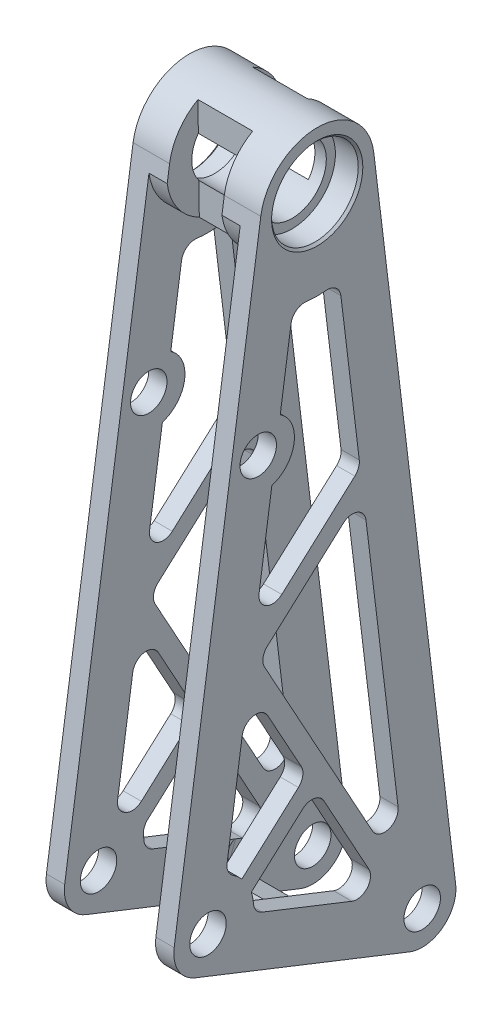
from build123d import *

# Parameters (mm, degrees)
SKETCH2_R               = 7.5
SKETCH2_R_2             = 4
BOSS_EXTRUDE1_DEPTH     = 14
SKETCH5_R               = 9.5
CUT_EXTRUDE2_DEPTH      = 5.5
CUT_EXTRUDE3_DEPTH      = 614.488906728
CUT_EXTRUDE3_DEPTH_BACK = 614.488906728
CUT_EXTRUDE4_DEPTH      = 10
BOSS_EXTRUDE2_DEPTH     = 10
FILLET2_R               = 3
FILLET3_R               = 3
BOSS_EXTRUDE4_DEPTH     = 4
BOSS_EXTRUDE5_START     = -4
BOSS_EXTRUDE5_DEPTH     = 4
CUT_EXTRUDE5_DEPTH      = 614.488906728
CUT_EXTRUDE5_DEPTH_BACK = 614.488906728
SKETCH13_R              = 4
CUT_EXTRUDE8_DEPTH      = 6
BOSS_EXTRUDE6_DEPTH     = 4
BOSS_EXTRUDE7_DEPTH     = 4
FILLET4_R               = 3
CHAMFER1_SIZE           = 0.5


with BuildPart() as part:
    # Sketch2 → Boss-Extrude1 (new, symmetric)
    with BuildSketch(Plane(origin=(-412.5, 0, 0), x_dir=(0, 0, -1), z_dir=(1, 0, 0))):
        with BuildLine():
            Line((-456.363295204, -382.527511362), (-437.367335694, -253.183682895))
            ThreePointArc((-437.367335694, -253.183682895), (-424.843445453, -242.500980411), (-412.591051315, -253.494014434))
            Line((-412.591051315, -253.494014434), (-394.642850355, -401.382752344))
            ThreePointArc((-394.642850355, -401.382752344), (-397.465286403, -408.130276264), (-404.70702593, -409.1561578))
            Line((-404.70702593, -409.1561578), (-451.698461175, -390.59274773))
            ThreePointArc((-451.698461175, -390.59274773), (-455.435165708, -387.372352264), (-456.363295204, -382.527511362))
        make_face()
        with Locations((-425, -255)):
            Circle(SKETCH2_R, mode=Mode.SUBTRACT)
        with Locations((-448.942893787, -383.617301625)):
            Circle(SKETCH2_R_2, mode=Mode.SUBTRACT)
        with Locations((-401.988401641, -402.274229495)):
            Circle(SKETCH2_R_2, mode=Mode.SUBTRACT)
    extrude(amount=BOSS_EXTRUDE1_DEPTH, both=True)

    # Sketch5 → Cut-Extrude2 (cut)
    with BuildSketch(Plane.ZY.offset(426.5)):
        with Locations((425, -255)):
            Circle(SKETCH5_R)
    cut_extrude2 = extrude(amount=-CUT_EXTRUDE2_DEPTH, mode=Mode.SUBTRACT)

    # Mirror1: Cut-Extrude2 across plane
    add(cut_extrude2.mirror(Plane(origin=(-412.5, 0, 0), x_dir=(0, 0, 1), z_dir=(1, 0, 0))), mode=Mode.SUBTRACT)

    # Sketch7 → Cut-Extrude3 (cut, two sides: drawn at the far end of the back side and taken through both)
    with BuildSketch(Plane(origin=(-412.5, 0, 0), x_dir=(0, 0, -1), z_dir=(1, 0, 0)).offset(-CUT_EXTRUDE3_DEPTH_BACK)):
        with BuildLine():
            Line((-430.742030576, -276.892443556), (-444.757842893, -372.326360609))
            ThreePointArc((-444.757842893, -372.326360609), (-444.527531575, -373.988727486), (-443.440423433, -375.267282463))
            ThreePointArc((-443.440423433, -375.267282463), (-440.325167232, -378.544354845), (-438.971721168, -382.858541714))
            ThreePointArc((-438.971721168, -382.858541714), (-438.395118428, -384.411078634), (-437.082596338, -385.421092184))
            Line((-437.082596338, -385.421092184), (-412.145396393, -395.272237741))
            ThreePointArc((-412.145396393, -395.272237741), (-409.456329, -392.454733995), (-406.02291409, -390.615964607))
            Line((-406.02291409, -390.615964607), (-419.808105653, -277.029394751))
            ThreePointArc((-419.808105653, -277.029394751), (-420.909833502, -275.050094523), (-423.081419559, -274.405387115))
            ThreePointArc((-423.081419559, -274.405387115), (-425.244225094, -274.498470558), (-427.404020675, -274.35124504))
            ThreePointArc((-427.404020675, -274.35124504), (-429.591073298, -274.941358989), (-430.742030576, -276.892443556))
        make_face()
    extrude(amount=CUT_EXTRUDE3_DEPTH + CUT_EXTRUDE3_DEPTH_BACK, mode=Mode.SUBTRACT)

    # Sketch8 → Cut-Extrude4 (cut, symmetric)
    with BuildSketch(Plane(origin=(-412.5, 0, 0), x_dir=(0, 0, -1), z_dir=(1, 0, 0))):
        with BuildLine():
            Line((-451.698461175, -390.59274773), (-404.70702593, -409.1561578))
            ThreePointArc((-404.70702593, -409.1561578), (-397.465286403, -408.130276264), (-394.642850355, -401.382752344))
            Line((-394.642850355, -401.382752344), (-412.160855789, -257.03871919))
            ThreePointArc((-412.160855789, -257.03871919), (-425.162816729, -267.998980372), (-437.886179639, -256.716500603))
            Line((-437.886179639, -256.716500603), (-456.363295204, -382.527511362))
            ThreePointArc((-456.363295204, -382.527511362), (-455.435165708, -387.372352264), (-451.698461175, -390.59274773))
        make_face()
    extrude(amount=CUT_EXTRUDE4_DEPTH, both=True, mode=Mode.SUBTRACT)

    # Sketch10 → Boss-Extrude2 (add, symmetric)
    with BuildSketch(Plane(origin=(-412.5, 0, 0), x_dir=(0, 0, -1), z_dir=(1, 0, 0))):
        Polygon((-428.204297472, -391.713098841), (-422.623940588, -393.917552751), (-424.460985513, -398.567850155), (-430.041342398, -396.363396244), align=None)
    extrude(amount=BOSS_EXTRUDE2_DEPTH, both=True)

    # Fillet2
    # the kernel refuses this fillet: 3 mm, written as the material it adds along each edge
    with BuildSketch(Plane(origin=(-422.5, -396.363396244, 430.041342398), x_dir=(0, 0.36740898506417274, 0.9300594807291169), z_dir=(0, 0.9300594807291169, -0.3674089850641727)), Plane(origin=(-422.5, -393.917552751, 422.623940588), x_dir=(0, -0.36740898506413927, -0.9300594807291301), z_dir=(0, -0.9300594807291301, 0.36740898506413927))) as fillet2_piece_1:
        with BuildLine():
            CenterArc((FILLET2_R, FILLET2_R), FILLET2_R, 180, 90)
            Line((0, FILLET2_R), (-FILLET2_R * 0.02, FILLET2_R))
            Line((-FILLET2_R * 0.02, FILLET2_R), (-FILLET2_R * 0.02, -FILLET2_R * 0.02))
            Line((-FILLET2_R * 0.02, -FILLET2_R * 0.02), (FILLET2_R, -FILLET2_R * 0.02))
            Line((FILLET2_R, -FILLET2_R * 0.02), (FILLET2_R, 0))
        make_face()
    extrude(amount=5)
    with BuildSketch(Plane(origin=(-422.5, -398.567850155, 424.460985513), x_dir=(-2.194748909688179e-14, -0.9300594807291194, 0.3674089850641664), z_dir=(0, 0.3674089850641664, 0.9300594807291194)), Plane(origin=(-422.5, -391.713098841, 428.204297472), x_dir=(-2.194748909688179e-14, 0.9300594807291187, -0.36740898506416797), z_dir=(0, -0.36740898506416797, -0.9300594807291188))) as fillet2_piece_2:
        with BuildLine():
            CenterArc((3, 2.971847642), FILLET2_R, 180, 82.144486147)
            Line((0, 2.971847642), (-0.06, 2.971847642))
            Line((-0.06, 2.971847642), (-0.06, 0))
            Line((-0.06, 0), (0, -0.06))
            ThreePointArc((0, -0.06), (1.294986834, -0.06), (2.581773142, -0.059436953))
            Line((2.581773142, -0.059436953), (2.589973669, 0))
        make_face()
    extrude(amount=6)
    with BuildSketch(Plane(origin=(-402.5, -396.363396244, 430.041342398), x_dir=(0, 0.36740898506417274, 0.9300594807291169), z_dir=(0, 0.9300594807291169, -0.3674089850641727)), Plane(origin=(-402.5, -393.917552751, 422.623940588), x_dir=(0, -0.36740898506413927, -0.9300594807291301), z_dir=(0, -0.9300594807291301, 0.36740898506413927))) as fillet2_piece_3:
        with BuildLine():
            CenterArc((FILLET2_R, -FILLET2_R), FILLET2_R, 90, 90)
            Line((0, -FILLET2_R), (-FILLET2_R * 0.02, -FILLET2_R))
            Line((-FILLET2_R * 0.02, -FILLET2_R), (-FILLET2_R * 0.02, FILLET2_R * 0.02))
            Line((-FILLET2_R * 0.02, FILLET2_R * 0.02), (FILLET2_R, FILLET2_R * 0.02))
            Line((FILLET2_R, FILLET2_R * 0.02), (FILLET2_R, 0))
        make_face()
    extrude(amount=5)
    with BuildSketch(Plane(origin=(-402.5, -398.567850155, 424.460985513), x_dir=(2.194748909688179e-14, -0.9300594807291194, 0.3674089850641664), z_dir=(0, 0.3674089850641664, 0.9300594807291194)), Plane(origin=(-402.5, -391.713098841, 428.204297472), x_dir=(2.194748909688179e-14, 0.9300594807291187, -0.36740898506416797), z_dir=(0, -0.36740898506416797, -0.9300594807291188))) as fillet2_piece_4:
        with BuildLine():
            CenterArc((3, -2.971847642), FILLET2_R, 97.855513853, 82.144486147)
            Line((0, -2.971847642), (-0.06, -2.971847642))
            Line((-0.06, -2.971847642), (-0.06, 0))
            Line((-0.06, 0), (0, 0.06))
            ThreePointArc((0, 0.06), (1.294986834, 0.06), (2.581773142, 0.059436953))
            Line((2.581773142, 0.059436953), (2.589973669, 0))
        make_face()
    extrude(amount=6)
    with BuildSketch(Plane(origin=(-422.5, -403.33884235, 432.796909786), x_dir=(0, 0.36740898506417274, 0.9300594807291169), z_dir=(0, 0.9300594807291169, -0.3674089850641727))) as fillet2_piece_5a_section:
        with BuildLine():
            CenterArc((FILLET2_R, FILLET2_R), FILLET2_R, 180, 90)
            Line((0, FILLET2_R), (-FILLET2_R * 0.02, FILLET2_R))
            Line((-FILLET2_R * 0.02, FILLET2_R), (-FILLET2_R * 0.02, -FILLET2_R * 0.02))
            Line((-FILLET2_R * 0.02, -FILLET2_R * 0.02), (FILLET2_R, -FILLET2_R * 0.02))
            Line((FILLET2_R, -FILLET2_R * 0.02), (FILLET2_R, 0))
        make_face()
    fillet2_piece_5a = extrude(amount=12.5, mode=Mode.PRIVATE)
    fillet2_piece_5a = split(fillet2_piece_5a, bisect_by=Plane(origin=(-421.820814657, -398.522687012, 431.624604762), z_dir=(0, 0.9300594807291132, -0.3674089850641823)), keep=Keep.TOP, mode=Mode.PRIVATE)
    fillet2_piece_5a = split(fillet2_piece_5a, bisect_by=Plane(origin=(-421.820814657, -396.113857447, 430.673025165), z_dir=(0, -0.9300594807291194, 0.3674089850641664)), keep=Keep.TOP, mode=Mode.PRIVATE)
    with BuildSketch(Plane(origin=(-422.5, -398.567850155, 424.460985513), x_dir=(-2.194748909688179e-14, -0.9300594807291194, 0.3674089850641664), z_dir=(0, 0.3674089850641664, 0.9300594807291194))) as fillet2_piece_5b_section:
        with BuildLine():
            CenterArc((3, 2.971847642), FILLET2_R, 180, 82.144486147)
            Line((0, 2.971847642), (-0.06, 2.971847642))
            Line((-0.06, 2.971847642), (-0.06, 0))
            Line((-0.06, 0), (0, -0.06))
            ThreePointArc((0, -0.06), (1.294986834, -0.06), (2.581773142, -0.059436953))
            Line((2.581773142, -0.059436953), (2.589973669, 0))
        make_face()
    fillet2_piece_5b = extrude(amount=13.429619105, mode=Mode.PRIVATE)
    fillet2_piece_5b = split(fillet2_piece_5b, bisect_by=Plane(origin=(-421.814393522, -396.951276814, 430.273577655), z_dir=(0, 0.3674089850641727, 0.9300594807291169)), keep=Keep.TOP, mode=Mode.PRIVATE)
    fillet2_piece_5 = fillet2_piece_5a & fillet2_piece_5b
    add(fillet2_piece_5)
    with BuildSketch(Plane(origin=(-422.5, -396.363396244, 430.041342398), x_dir=(0, 0.36740898506417274, 0.9300594807291169), z_dir=(0, 0.9300594807291169, -0.3674089850641727))) as fillet2_piece_6a_section:
        with BuildLine():
            CenterArc((FILLET2_R, FILLET2_R), FILLET2_R, 180, 90)
            Line((0, FILLET2_R), (-FILLET2_R * 0.02, FILLET2_R))
            Line((-FILLET2_R * 0.02, FILLET2_R), (-FILLET2_R * 0.02, -FILLET2_R * 0.02))
            Line((-FILLET2_R * 0.02, -FILLET2_R * 0.02), (FILLET2_R, -FILLET2_R * 0.02))
            Line((FILLET2_R, -FILLET2_R * 0.02), (FILLET2_R, 0))
        make_face()
    fillet2_piece_6a = extrude(amount=12.5, mode=Mode.PRIVATE)
    fillet2_piece_6a = split(fillet2_piece_6a, bisect_by=Plane(origin=(-421.820814657, -389.054730477, 427.884400642), z_dir=(0, -0.9300594807291158, 0.36740898506417546)), keep=Keep.TOP, mode=Mode.PRIVATE)
    fillet2_piece_6a = split(fillet2_piece_6a, bisect_by=Plane(origin=(-421.820814657, -391.463560043, 428.835980239), z_dir=(0, 0.9300594807291188, -0.36740898506416797)), keep=Keep.TOP, mode=Mode.PRIVATE)
    with BuildSketch(Plane(origin=(-422.5, -388.983390026, 435.114285159), x_dir=(2.194748909688179e-14, 0.9300594807291187, -0.36740898506416797), z_dir=(0, -0.36740898506416797, -0.9300594807291188))) as fillet2_piece_6b_section:
        with BuildLine():
            CenterArc((3, 2.971847642), FILLET2_R, 180, 82.144486147)
            Line((0, 2.971847642), (-0.06, 2.971847642))
            Line((-0.06, 2.971847642), (-0.06, 0))
            Line((-0.06, 0), (0, -0.06))
            ThreePointArc((0, -0.06), (1.294986834, -0.06), (2.581773142, -0.059436953))
            Line((2.581773142, -0.059436953), (2.589973669, 0))
        make_face()
    fillet2_piece_6b = extrude(amount=13.429619105, mode=Mode.PRIVATE)
    fillet2_piece_6b = split(fillet2_piece_6b, bisect_by=Plane(origin=(-421.814393522, -391.125218271, 427.972062214), z_dir=(0, 0.3674089850641727, 0.9300594807291169)), keep=Keep.TOP, mode=Mode.PRIVATE)
    fillet2_piece_6 = fillet2_piece_6a & fillet2_piece_6b
    add(fillet2_piece_6)
    with BuildSketch(Plane(origin=(-422.5, -401.297558969, 417.550997826), x_dir=(0, -0.9300594807291194, 0.36740898506416636), z_dir=(0, 0.3674089850641664, 0.9300594807291194))) as fillet2_piece_7a_section:
        with BuildLine():
            CenterArc((3, 2.971847642), FILLET2_R, 180, 82.144486147)
            Line((0, 2.971847642), (-0.06, 2.971847642))
            Line((-0.06, 2.971847642), (-0.06, 0))
            Line((-0.06, 0), (0, -0.06))
            ThreePointArc((0, -0.06), (1.294986834, -0.06), (2.581773142, -0.059436953))
            Line((2.581773142, -0.059436953), (2.589973669, 0))
        make_face()
    fillet2_piece_7a = extrude(amount=13.429619105, mode=Mode.PRIVATE)
    fillet2_piece_7a = split(fillet2_piece_7a, bisect_by=Plane(origin=(-421.814393522, -399.155730724, 424.693220771), z_dir=(0, -0.36740898506413927, -0.9300594807291301)), keep=Keep.TOP, mode=Mode.PRIVATE)
    with BuildSketch(Plane(origin=(-422.5, -393.917552751, 422.623940588), x_dir=(0, -0.36740898506413927, -0.9300594807291301), z_dir=(0, -0.9300594807291301, 0.36740898506413927))) as fillet2_piece_7b_section:
        with BuildLine():
            CenterArc((FILLET2_R, FILLET2_R), FILLET2_R, 180, 90)
            Line((0, FILLET2_R), (-FILLET2_R * 0.02, FILLET2_R))
            Line((-FILLET2_R * 0.02, FILLET2_R), (-FILLET2_R * 0.02, -FILLET2_R * 0.02))
            Line((-FILLET2_R * 0.02, -FILLET2_R * 0.02), (FILLET2_R, -FILLET2_R * 0.02))
            Line((FILLET2_R, -FILLET2_R * 0.02), (FILLET2_R, 0))
        make_face()
    fillet2_piece_7b = extrude(amount=12.5, mode=Mode.PRIVATE)
    fillet2_piece_7b = split(fillet2_piece_7b, bisect_by=Plane(origin=(-421.820814657, -401.226218518, 424.780882343), z_dir=(0, 0.9300594807291132, -0.3674089850641823)), keep=Keep.TOP, mode=Mode.PRIVATE)
    fillet2_piece_7b = split(fillet2_piece_7b, bisect_by=Plane(origin=(-421.820814657, -398.817388952, 423.829302746), z_dir=(0, -0.9300594807291194, 0.3674089850641664)), keep=Keep.TOP, mode=Mode.PRIVATE)
    fillet2_piece_7 = fillet2_piece_7a & fillet2_piece_7b
    add(fillet2_piece_7)
    with BuildSketch(Plane(origin=(-422.5, -386.942106645, 419.8683732), x_dir=(0, -0.36740898506413927, -0.9300594807291301), z_dir=(0, -0.9300594807291301, 0.36740898506413927))) as fillet2_piece_8a_section:
        with BuildLine():
            CenterArc((FILLET2_R, FILLET2_R), FILLET2_R, 180, 90)
            Line((0, FILLET2_R), (-FILLET2_R * 0.02, FILLET2_R))
            Line((-FILLET2_R * 0.02, FILLET2_R), (-FILLET2_R * 0.02, -FILLET2_R * 0.02))
            Line((-FILLET2_R * 0.02, -FILLET2_R * 0.02), (FILLET2_R, -FILLET2_R * 0.02))
            Line((FILLET2_R, -FILLET2_R * 0.02), (FILLET2_R, 0))
        make_face()
    fillet2_piece_8a = extrude(amount=12.5, mode=Mode.PRIVATE)
    fillet2_piece_8a = split(fillet2_piece_8a, bisect_by=Plane(origin=(-421.820814657, -391.758261983, 421.040678224), z_dir=(0, -0.9300594807291158, 0.36740898506417546)), keep=Keep.TOP, mode=Mode.PRIVATE)
    fillet2_piece_8a = split(fillet2_piece_8a, bisect_by=Plane(origin=(-421.820814657, -394.167091548, 421.992257821), z_dir=(0, 0.9300594807291188, -0.36740898506416797)), keep=Keep.TOP, mode=Mode.PRIVATE)
    with BuildSketch(Plane(origin=(-422.5, -391.713098841, 428.204297472), x_dir=(-2.194748909688179e-14, 0.9300594807291187, -0.36740898506416797), z_dir=(0, -0.36740898506416797, -0.9300594807291188))) as fillet2_piece_8b_section:
        with BuildLine():
            CenterArc((3, 2.971847642), FILLET2_R, 180, 82.144486147)
            Line((0, 2.971847642), (-0.06, 2.971847642))
            Line((-0.06, 2.971847642), (-0.06, 0))
            Line((-0.06, 0), (0, -0.06))
            ThreePointArc((0, -0.06), (1.294986834, -0.06), (2.581773142, -0.059436953))
            Line((2.581773142, -0.059436953), (2.589973669, 0))
        make_face()
    fillet2_piece_8b = extrude(amount=13.429619105, mode=Mode.PRIVATE)
    fillet2_piece_8b = split(fillet2_piece_8b, bisect_by=Plane(origin=(-421.814393522, -393.329672181, 422.39170533), z_dir=(0, -0.36740898506413927, -0.9300594807291301)), keep=Keep.TOP, mode=Mode.PRIVATE)
    fillet2_piece_8 = fillet2_piece_8a & fillet2_piece_8b
    add(fillet2_piece_8)
    with BuildSketch(Plane(origin=(-402.5, -403.33884235, 432.796909786), x_dir=(0, 0.36740898506417274, 0.9300594807291169), z_dir=(0, 0.9300594807291169, -0.3674089850641727))) as fillet2_piece_9a_section:
        with BuildLine():
            CenterArc((FILLET2_R, -FILLET2_R), FILLET2_R, 90, 90)
            Line((0, -FILLET2_R), (-FILLET2_R * 0.02, -FILLET2_R))
            Line((-FILLET2_R * 0.02, -FILLET2_R), (-FILLET2_R * 0.02, FILLET2_R * 0.02))
            Line((-FILLET2_R * 0.02, FILLET2_R * 0.02), (FILLET2_R, FILLET2_R * 0.02))
            Line((FILLET2_R, FILLET2_R * 0.02), (FILLET2_R, 0))
        make_face()
    fillet2_piece_9a = extrude(amount=12.5, mode=Mode.PRIVATE)
    fillet2_piece_9a = split(fillet2_piece_9a, bisect_by=Plane(origin=(-403.179185343, -398.522687012, 431.624604762), z_dir=(0, 0.9300594807291132, -0.3674089850641823)), keep=Keep.TOP, mode=Mode.PRIVATE)
    fillet2_piece_9a = split(fillet2_piece_9a, bisect_by=Plane(origin=(-403.179185343, -396.113857447, 430.673025165), z_dir=(0, -0.9300594807291194, 0.3674089850641664)), keep=Keep.TOP, mode=Mode.PRIVATE)
    with BuildSketch(Plane(origin=(-402.5, -398.567850155, 424.460985513), x_dir=(2.194748909688179e-14, -0.9300594807291194, 0.3674089850641664), z_dir=(0, 0.3674089850641664, 0.9300594807291194))) as fillet2_piece_9b_section:
        with BuildLine():
            CenterArc((3, -2.971847642), FILLET2_R, 97.855513853, 82.144486147)
            Line((0, -2.971847642), (-0.06, -2.971847642))
            Line((-0.06, -2.971847642), (-0.06, 0))
            Line((-0.06, 0), (0, 0.06))
            ThreePointArc((0, 0.06), (1.294986834, 0.06), (2.581773142, 0.059436953))
            Line((2.581773142, 0.059436953), (2.589973669, 0))
        make_face()
    fillet2_piece_9b = extrude(amount=13.429619105, mode=Mode.PRIVATE)
    fillet2_piece_9b = split(fillet2_piece_9b, bisect_by=Plane(origin=(-403.185606478, -396.951276814, 430.273577655), z_dir=(0, 0.3674089850641727, 0.9300594807291169)), keep=Keep.TOP, mode=Mode.PRIVATE)
    fillet2_piece_9 = fillet2_piece_9a & fillet2_piece_9b
    add(fillet2_piece_9)
    with BuildSketch(Plane(origin=(-402.5, -396.363396244, 430.041342398), x_dir=(0, 0.36740898506417274, 0.9300594807291169), z_dir=(0, 0.9300594807291169, -0.3674089850641727))) as fillet2_piece_10a_section:
        with BuildLine():
            CenterArc((FILLET2_R, -FILLET2_R), FILLET2_R, 90, 90)
            Line((0, -FILLET2_R), (-FILLET2_R * 0.02, -FILLET2_R))
            Line((-FILLET2_R * 0.02, -FILLET2_R), (-FILLET2_R * 0.02, FILLET2_R * 0.02))
            Line((-FILLET2_R * 0.02, FILLET2_R * 0.02), (FILLET2_R, FILLET2_R * 0.02))
            Line((FILLET2_R, FILLET2_R * 0.02), (FILLET2_R, 0))
        make_face()
    fillet2_piece_10a = extrude(amount=12.5, mode=Mode.PRIVATE)
    fillet2_piece_10a = split(fillet2_piece_10a, bisect_by=Plane(origin=(-403.179185343, -389.054730477, 427.884400642), z_dir=(0, -0.9300594807291158, 0.36740898506417546)), keep=Keep.TOP, mode=Mode.PRIVATE)
    fillet2_piece_10a = split(fillet2_piece_10a, bisect_by=Plane(origin=(-403.179185343, -391.463560043, 428.835980239), z_dir=(0, 0.9300594807291188, -0.36740898506416797)), keep=Keep.TOP, mode=Mode.PRIVATE)
    with BuildSketch(Plane(origin=(-402.5, -388.983390026, 435.114285159), x_dir=(-2.194748909688179e-14, 0.9300594807291187, -0.36740898506416797), z_dir=(0, -0.36740898506416797, -0.9300594807291188))) as fillet2_piece_10b_section:
        with BuildLine():
            CenterArc((3, -2.971847642), FILLET2_R, 97.855513853, 82.144486147)
            Line((0, -2.971847642), (-0.06, -2.971847642))
            Line((-0.06, -2.971847642), (-0.06, 0))
            Line((-0.06, 0), (0, 0.06))
            ThreePointArc((0, 0.06), (1.294986834, 0.06), (2.581773142, 0.059436953))
            Line((2.581773142, 0.059436953), (2.589973669, 0))
        make_face()
    fillet2_piece_10b = extrude(amount=13.429619105, mode=Mode.PRIVATE)
    fillet2_piece_10b = split(fillet2_piece_10b, bisect_by=Plane(origin=(-403.185606478, -391.125218271, 427.972062214), z_dir=(0, 0.3674089850641727, 0.9300594807291169)), keep=Keep.TOP, mode=Mode.PRIVATE)
    fillet2_piece_10 = fillet2_piece_10a & fillet2_piece_10b
    add(fillet2_piece_10)
    with BuildSketch(Plane(origin=(-402.5, -401.297558969, 417.550997826), x_dir=(0, -0.9300594807291194, 0.36740898506416636), z_dir=(0, 0.3674089850641664, 0.9300594807291194))) as fillet2_piece_11a_section:
        with BuildLine():
            CenterArc((3, -2.971847642), FILLET2_R, 97.855513853, 82.144486147)
            Line((0, -2.971847642), (-0.06, -2.971847642))
            Line((-0.06, -2.971847642), (-0.06, 0))
            Line((-0.06, 0), (0, 0.06))
            ThreePointArc((0, 0.06), (1.294986834, 0.06), (2.581773142, 0.059436953))
            Line((2.581773142, 0.059436953), (2.589973669, 0))
        make_face()
    fillet2_piece_11a = extrude(amount=13.429619105, mode=Mode.PRIVATE)
    fillet2_piece_11a = split(fillet2_piece_11a, bisect_by=Plane(origin=(-403.185606478, -399.155730724, 424.693220771), z_dir=(0, -0.36740898506413927, -0.9300594807291301)), keep=Keep.TOP, mode=Mode.PRIVATE)
    with BuildSketch(Plane(origin=(-402.5, -393.917552751, 422.623940588), x_dir=(0, -0.36740898506413927, -0.9300594807291301), z_dir=(0, -0.9300594807291301, 0.36740898506413927))) as fillet2_piece_11b_section:
        with BuildLine():
            CenterArc((FILLET2_R, -FILLET2_R), FILLET2_R, 90, 90)
            Line((0, -FILLET2_R), (-FILLET2_R * 0.02, -FILLET2_R))
            Line((-FILLET2_R * 0.02, -FILLET2_R), (-FILLET2_R * 0.02, FILLET2_R * 0.02))
            Line((-FILLET2_R * 0.02, FILLET2_R * 0.02), (FILLET2_R, FILLET2_R * 0.02))
            Line((FILLET2_R, FILLET2_R * 0.02), (FILLET2_R, 0))
        make_face()
    fillet2_piece_11b = extrude(amount=12.5, mode=Mode.PRIVATE)
    fillet2_piece_11b = split(fillet2_piece_11b, bisect_by=Plane(origin=(-403.179185343, -401.226218518, 424.780882343), z_dir=(0, 0.9300594807291132, -0.3674089850641823)), keep=Keep.TOP, mode=Mode.PRIVATE)
    fillet2_piece_11b = split(fillet2_piece_11b, bisect_by=Plane(origin=(-403.179185343, -398.817388952, 423.829302746), z_dir=(0, -0.9300594807291194, 0.3674089850641664)), keep=Keep.TOP, mode=Mode.PRIVATE)
    fillet2_piece_11 = fillet2_piece_11a & fillet2_piece_11b
    add(fillet2_piece_11)
    with BuildSketch(Plane(origin=(-402.5, -386.942106645, 419.8683732), x_dir=(0, -0.36740898506413927, -0.9300594807291301), z_dir=(0, -0.9300594807291301, 0.36740898506413927))) as fillet2_piece_12a_section:
        with BuildLine():
            CenterArc((FILLET2_R, -FILLET2_R), FILLET2_R, 90, 90)
            Line((0, -FILLET2_R), (-FILLET2_R * 0.02, -FILLET2_R))
            Line((-FILLET2_R * 0.02, -FILLET2_R), (-FILLET2_R * 0.02, FILLET2_R * 0.02))
            Line((-FILLET2_R * 0.02, FILLET2_R * 0.02), (FILLET2_R, FILLET2_R * 0.02))
            Line((FILLET2_R, FILLET2_R * 0.02), (FILLET2_R, 0))
        make_face()
    fillet2_piece_12a = extrude(amount=12.5, mode=Mode.PRIVATE)
    fillet2_piece_12a = split(fillet2_piece_12a, bisect_by=Plane(origin=(-403.179185343, -391.758261983, 421.040678224), z_dir=(0, -0.9300594807291158, 0.36740898506417546)), keep=Keep.TOP, mode=Mode.PRIVATE)
    fillet2_piece_12a = split(fillet2_piece_12a, bisect_by=Plane(origin=(-403.179185343, -394.167091548, 421.992257821), z_dir=(0, 0.9300594807291188, -0.36740898506416797)), keep=Keep.TOP, mode=Mode.PRIVATE)
    with BuildSketch(Plane(origin=(-402.5, -391.713098841, 428.204297472), x_dir=(2.194748909688179e-14, 0.9300594807291187, -0.36740898506416797), z_dir=(0, -0.36740898506416797, -0.9300594807291188))) as fillet2_piece_12b_section:
        with BuildLine():
            CenterArc((3, -2.971847642), FILLET2_R, 97.855513853, 82.144486147)
            Line((0, -2.971847642), (-0.06, -2.971847642))
            Line((-0.06, -2.971847642), (-0.06, 0))
            Line((-0.06, 0), (0, 0.06))
            ThreePointArc((0, 0.06), (1.294986834, 0.06), (2.581773142, 0.059436953))
            Line((2.581773142, 0.059436953), (2.589973669, 0))
        make_face()
    fillet2_piece_12b = extrude(amount=13.429619105, mode=Mode.PRIVATE)
    fillet2_piece_12b = split(fillet2_piece_12b, bisect_by=Plane(origin=(-403.185606478, -393.329672181, 422.39170533), z_dir=(0, -0.36740898506413927, -0.9300594807291301)), keep=Keep.TOP, mode=Mode.PRIVATE)
    fillet2_piece_12 = fillet2_piece_12a & fillet2_piece_12b
    add(fillet2_piece_12)

    # Fillet3
    fillet3_edges = [part.edges().sort_by_distance(p)[0] for p in [
        (-424.5, -390.615964607, 406.02291409),
        (-424.5, -395.272237741, 412.145396393),
        (-400.5, -390.615964607, 406.02291409),
        (-400.5, -395.272237741, 412.145396393),
    ]]
    fillet(fillet3_edges, radius=FILLET3_R)

    # Sketch11 → Boss-Extrude4 (add)
    with BuildSketch(Plane.ZY.offset(426.5)):
        with BuildLine():
            Line((433.562683095, -292.691966319), (435.462236782, -305.626061387))
            ThreePointArc((435.462236782, -305.626061387), (430.065204559, -299.812155825), (433.562683095, -292.691966319))
        make_face()
    extrude(amount=-BOSS_EXTRUDE4_DEPTH)

    # Sketch12 → Boss-Extrude5 (add)
    with BuildSketch(Plane(origin=(-398.5, 0, 0), x_dir=(0, 0, -1), z_dir=(1, 0, 0)).offset(BOSS_EXTRUDE5_START)):
        with BuildLine():
            Line((-433.562683095, -292.691966319), (-435.462236782, -305.626061387))
            ThreePointArc((-435.462236782, -305.626061387), (-430.065204559, -299.812155825), (-433.562683095, -292.691966319))
        make_face()
    extrude(amount=BOSS_EXTRUDE5_DEPTH)

    # Sketch13 → Cut-Extrude5 (cut, two sides: drawn at the far end of the back side and taken through both)
    with BuildSketch(Plane(origin=(-412.5, 0, 0), x_dir=(0, 0, -1), z_dir=(1, 0, 0)).offset(-CUT_EXTRUDE5_DEPTH_BACK)):
        with Locations((-437.926841531, -298.28571727)):
            Circle(SKETCH13_R)
    extrude(amount=CUT_EXTRUDE5_DEPTH + CUT_EXTRUDE5_DEPTH_BACK, mode=Mode.SUBTRACT)

    # Sketch15 → Cut-Extrude8 (cut, symmetric)
    with BuildSketch(Plane(origin=(-412.5, 0, 0), x_dir=(0, 0, -1), z_dir=(1, 0, 0))):
        with BuildLine():
            Line((-431.151277421, -243.54741138), (-430.847683028, -266.610538455))
            ThreePointArc((-430.847683028, -266.610538455), (-437.998873819, -255.171112321), (-431.151277421, -243.54741138))
        make_face()
        with BuildLine():
            Line((-419.152316972, -243.389461545), (-418.848722579, -266.45258862))
            ThreePointArc((-418.848722579, -266.45258862), (-412.001126181, -254.828887679), (-419.152316972, -243.389461545))
        make_face()
    extrude(amount=CUT_EXTRUDE8_DEPTH, both=True, mode=Mode.SUBTRACT)

    # Sketch16 → Boss-Extrude6 (add)
    with BuildSketch(Plane.ZY.offset(426.5)):
        Polygon((407.270983582, -392.305966569), (437.686949179, -337.093406704), (411.744850469, -313.683790531), (411.073498127, -307.690154714), (442.719902851, -336.24721928), (427.352025383, -364.143747897), (444.347615127, -379.480218435), (441.356236151, -382.168680862), (425.369480363, -367.742561332), (410.779705953, -394.226638926), align=None)
    extrude(amount=-BOSS_EXTRUDE6_DEPTH)

    # Sketch17 → Boss-Extrude7 (add)
    with BuildSketch(Plane(origin=(-398.5, 0, 0), x_dir=(0, 0, -1), z_dir=(1, 0, 0))):
        Polygon((-407.270983582, -392.305966569), (-437.686949179, -337.093406704), (-411.744850469, -313.683790531), (-411.073498127, -307.690154714), (-442.719902851, -336.24721928), (-427.352025383, -364.143747897), (-444.347615127, -379.480218435), (-441.356236151, -382.168680862), (-425.369480363, -367.742561332), (-410.779705953, -394.226638926), align=None)
    extrude(amount=-BOSS_EXTRUDE7_DEPTH)

    # Fillet4
    fillet4_edges = [part.edges().sort_by_distance(p)[0] for p in [
        (-400.5, -340.920493365, 440.145449789),
    ]]
    fillet(fillet4_edges, radius=FILLET4_R)
    fillet4_2_edges = [part.edges().sort_by_distance(p)[0] for p in [
        (-400.5, -332.855218242, 438.960950757),
    ]]
    fillet(fillet4_2_edges, radius=FILLET4_R)
    fillet4_3_edges = [part.edges().sort_by_distance(p)[0] for p in [
        (-400.5, -311.767706396, 415.592164621),
    ]]
    fillet(fillet4_3_edges, radius=FILLET4_R)
    fillet4_4_edges = [part.edges().sort_by_distance(p)[0] for p in [
        (-400.5, -316.623719665, 415.002824937),
    ]]
    fillet(fillet4_4_edges, radius=FILLET4_R)
    fillet4_5_edges = [part.edges().sort_by_distance(p)[0] for p in [
        (-400.5, -367.742561332, 425.369480363),
    ]]
    fillet(fillet4_5_edges, radius=FILLET4_R)
    fillet4_6_edges = [part.edges().sort_by_distance(p)[0] for p in [
        (-400.5, -364.143747897, 427.352025383),
    ]]
    fillet(fillet4_6_edges, radius=FILLET4_R)
    fillet4_7_edges = [part.edges().sort_by_distance(p)[0] for p in [
        (-400.5, -337.093406704, 437.686949179),
    ]]
    fillet(fillet4_7_edges, radius=FILLET4_R)
    fillet4_8_edges = [part.edges().sort_by_distance(p)[0] for p in [
        (-424.5, -367.742561332, 425.369480363),
    ]]
    fillet(fillet4_8_edges, radius=FILLET4_R)
    fillet4_9_edges = [part.edges().sort_by_distance(p)[0] for p in [
        (-424.5, -380.45423813, 439.456322788),
    ]]
    fillet(fillet4_9_edges, radius=FILLET4_R)
    fillet4_10_edges = [part.edges().sort_by_distance(p)[0] for p in [
        (-424.5, -376.92319427, 441.513968783),
    ]]
    fillet(fillet4_10_edges, radius=FILLET4_R)
    fillet4_11_edges = [part.edges().sort_by_distance(p)[0] for p in [
        (-424.5, -364.143747897, 427.352025383),
    ]]
    fillet(fillet4_11_edges, radius=FILLET4_R)
    fillet4_12_edges = [part.edges().sort_by_distance(p)[0] for p in [
        (-424.5, -340.920493365, 440.145449789),
    ]]
    fillet(fillet4_12_edges, radius=FILLET4_R)
    fillet4_13_edges = [part.edges().sort_by_distance(p)[0] for p in [
        (-424.5, -332.855218242, 438.960950757),
    ]]
    fillet(fillet4_13_edges, radius=FILLET4_R)
    fillet4_14_edges = [part.edges().sort_by_distance(p)[0] for p in [
        (-424.5, -311.767706396, 415.592164621),
    ]]
    fillet(fillet4_14_edges, radius=FILLET4_R)
    fillet4_15_edges = [part.edges().sort_by_distance(p)[0] for p in [
        (-424.5, -316.623719665, 415.002824937),
    ]]
    fillet(fillet4_15_edges, radius=FILLET4_R)
    fillet4_16_edges = [part.edges().sort_by_distance(p)[0] for p in [
        (-424.5, -337.093406704, 437.686949179),
    ]]
    fillet(fillet4_16_edges, radius=FILLET4_R)
    fillet4_17_edges = [part.edges().sort_by_distance(p)[0] for p in [
        (-424.5, -391.380709753, 407.780696943),
    ]]
    fillet(fillet4_17_edges, radius=FILLET4_R)
    fillet4_18_edges = [part.edges().sort_by_distance(p)[0] for p in [
        (-400.5, -393.837943192, 410.993833973),
    ]]
    fillet(fillet4_18_edges, radius=FILLET4_R)
    fillet4_19_edges = [part.edges().sort_by_distance(p)[0] for p in [
        (-400.5, -391.380709753, 407.780696943),
    ]]
    fillet(fillet4_19_edges, radius=FILLET4_R)
    fillet4_20_edges = [part.edges().sort_by_distance(p)[0] for p in [
        (-424.5, -393.837943192, 410.993833973),
    ]]
    fillet(fillet4_20_edges, radius=FILLET4_R)

    # Chamfer1
    chamfer1_edges = [part.edges().sort_by_distance(p)[0] for p in [
        (-426.5, -255, 415.5),
        (-398.5, -255, 415.5),
    ]]
    chamfer(chamfer1_edges, length=CHAMFER1_SIZE)


solid = part.part
